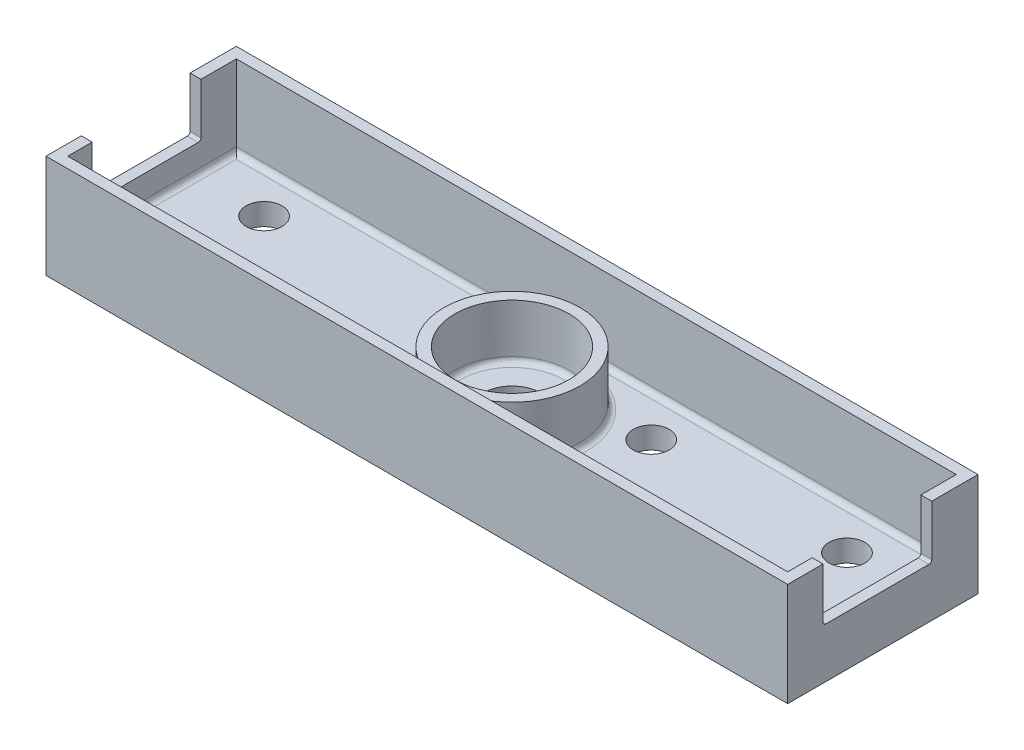
from build123d import *

# Parameters (mm, degrees)
SKETCH1_W                 = 34.1
SKETCH1_H                 = 17.5
BOSS_EXTRUDE1_DEPTH       = 9.5
SHELL1_T                  = -1
SHELL1_THICKNESS_2_FACE_W = 15.5
SHELL1_THICKNESS_2_FACE_H = 33.1
SHELL1_THICKNESS_2_DEPTH  = 1
SKETCH2_R                 = 1.65
CUT_EXTRUDE1_DEPTH        = 37.463989085
CUT_EXTRUDE3_REACH        = 38.464
SKETCH4_W                 = 10
SKETCH4_H                 = 4.9
SKETCH5_R                 = 2.65
CUT_EXTRUDE4_DEPTH        = 36.994756563
SKETCH6_R                 = 6.25
SKETCH6_R_2               = 5.25
BOSS_EXTRUDE2_DEPTH       = 5
FILLET3_R                 = 0.25
FILLET4_R                 = 0.5


with BuildPart() as part:
    # Sketch1 → Boss-Extrude1 (new body)
    with BuildSketch(Plane(origin=(0, 0, 0), x_dir=(1, 0, 0), z_dir=(0, 1, 0))):
        with Locations((-17.05, 0)):
            Rectangle(SKETCH1_W, SKETCH1_H)
    extrude(amount=BOSS_EXTRUDE1_DEPTH)

    # Shell1
    shell1_openings = [part.faces().sort_by_distance(p)[0] for p in [
        (-17.05, 9.5, 0),
        (0, 4.75, 0),
    ]]
    offset(amount=SHELL1_T, openings=shell1_openings, kind=Kind.INTERSECTION)

    # Shell1 thickness 2 face (on inner face of the shell) → Shell1 thickness 2 (add)
    with BuildSketch(Plane(origin=(-16.55, 1, 0), x_dir=(0, 0, -1), z_dir=(0, -1, 0))):
        Rectangle(SHELL1_THICKNESS_2_FACE_W, SHELL1_THICKNESS_2_FACE_H)
    extrude(amount=-SHELL1_THICKNESS_2_DEPTH)

    # Sketch2 → Cut-Extrude1 (cut, through all)
    with BuildSketch(Plane.XZ):
        with Locations((-8.8, 4)):
            Circle(SKETCH2_R)
        with Locations((-26.8, 4)):
            Circle(SKETCH2_R)
        with Locations((-8.8, -4)):
            Circle(SKETCH2_R)
        with Locations((-26.8, -4)):
            Circle(SKETCH2_R)
    extrude(amount=-CUT_EXTRUDE1_DEPTH, mode=Mode.SUBTRACT)

    # Sketch4 → Cut-Extrude3 (cut, up to next)
    with BuildSketch(Plane.ZY.offset(34.1), mode=Mode.PRIVATE) as cut_extrude3_sk1:
        with Locations((0.5, 7.05)):
            Rectangle(SKETCH4_W, SKETCH4_H)
    cut_extrude3_tool1 = extrude(cut_extrude3_sk1.sketch, amount=-CUT_EXTRUDE3_REACH, mode=Mode.PRIVATE) & part.part
    add(cut_extrude3_tool1.solids().sort_by_distance((-34.1, 7.05, 0.5))[0], mode=Mode.SUBTRACT)

    # Mirror1: part across plane


with BuildPart() as part_1:
    add(part.part)
    add(part.part.mirror(Plane(origin=(0, 0, 0), x_dir=(0, 0, 1), z_dir=(1, 0, 0))))

    # Sketch5 → Cut-Extrude4 (cut, through all)
    with BuildSketch(Plane(origin=(0, 2, 0), x_dir=(1, 0, 0), z_dir=(0, 1, 0))):
        Circle(SKETCH5_R)
    extrude(amount=-CUT_EXTRUDE4_DEPTH, mode=Mode.SUBTRACT)

    # Sketch6 → Boss-Extrude2 (add)
    with BuildSketch(Plane(origin=(0, 2, 0), x_dir=(1, 0, 0), z_dir=(0, 1, 0))):
        Circle(SKETCH6_R)
        Circle(SKETCH6_R_2, mode=Mode.SUBTRACT)
    extrude(amount=BOSS_EXTRUDE2_DEPTH)

    # Fillet3
    fillet3_edges = [part_1.edges().sort_by_distance(p)[0] for p in [
        (-33.6, 4.6, 5.5),
        (-33.6, 4.6, -4.5),
        (33.6, 4.6, -4.5),
        (33.6, 4.6, 5.5),
    ]]
    fillet(fillet3_edges, radius=FILLET3_R)

    # Fillet4
    fillet4_edges = [part_1.edges().sort_by_distance(p)[0] for p in [
        (-6.25, 2, 0),
        (-5.25, 2, 0),
        (-33.1, 2, 0),
        (0, 2, -7.75),
        (33.1, 2, 0),
        (0, 2, 7.75),
    ]]
    fillet(fillet4_edges, radius=FILLET4_R)


solid = part_1.part
